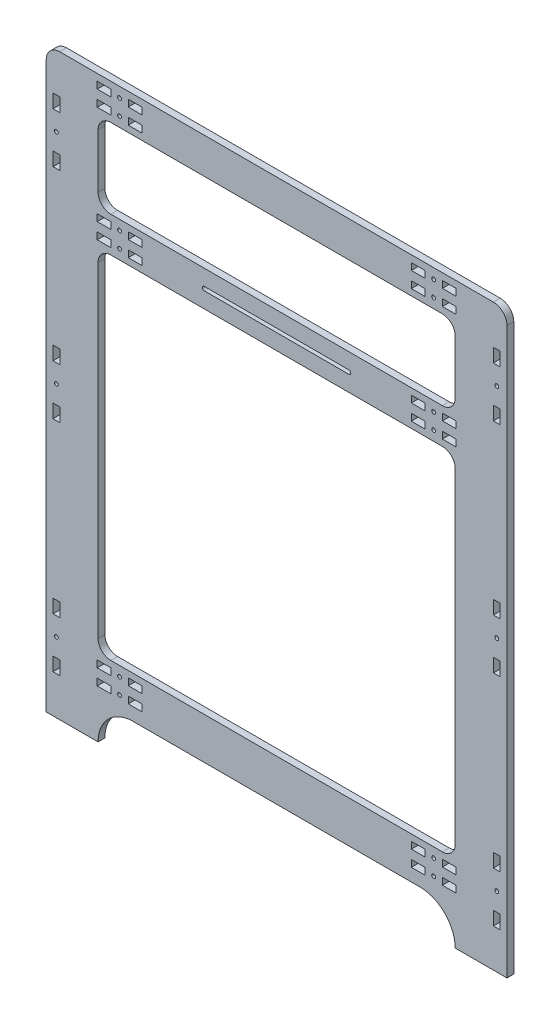
from build123d import *

# Parameters (mm, degrees)
SKETCH1_SIDE_SKETCH_2_W   = 5.333
SKETCH1_SIDE_SKETCH_2_H   = 10.666
SKETCH1_SIDE_SKETCH_2_W_2 = 10.666
SKETCH1_SIDE_SKETCH_2_H_2 = 5.333
SKETCH1_SIDE_SKETCH_2_R   = 1.5
BOSS_EXTRUDE1_DEPTH       = 5.333


with BuildPart() as part:
    # Sketch1-Side Sketch<2> → Boss-Extrude1 (new body)
    with BuildSketch(Plane.XY):
        with BuildLine():
            Line((170, 100.666), (-170, 100.666))
            ThreePointArc((-170, 100.666), (-177.542000928, 97.542000928), (-180.666, 90))
            Line((-180.666, 90), (-180.666, -353))
            Line((-180.666, -353), (-140, -353))
            ThreePointArc((-140, -353), (-131.896523315, -333.436476685), (-112.333, -325.333))
            Line((-112.333, -325.333), (112.333, -325.333))
            ThreePointArc((112.333, -325.333), (131.896523315, -333.436476685), (140, -353))
            Line((140, -353), (180.666, -353))
            Line((180.666, -353), (180.666, 90))
            ThreePointArc((180.666, 90), (177.542000928, 97.542000928), (170, 100.666))
        make_face()
        with Locations((172.6665, 64.667)):
            Rectangle(SKETCH1_SIDE_SKETCH_2_W, SKETCH1_SIDE_SKETCH_2_H, mode=Mode.SUBTRACT)
        with Locations((172.6665, 25.333)):
            Rectangle(SKETCH1_SIDE_SKETCH_2_W, SKETCH1_SIDE_SKETCH_2_H, mode=Mode.SUBTRACT)
        with Locations((172.6665, -106.5)):
            Rectangle(SKETCH1_SIDE_SKETCH_2_W, SKETCH1_SIDE_SKETCH_2_H, mode=Mode.SUBTRACT)
        with Locations((172.6665, -145.834)):
            Rectangle(SKETCH1_SIDE_SKETCH_2_W, SKETCH1_SIDE_SKETCH_2_H, mode=Mode.SUBTRACT)
        with Locations((172.6665, -278.333)):
            Rectangle(SKETCH1_SIDE_SKETCH_2_W, SKETCH1_SIDE_SKETCH_2_H, mode=Mode.SUBTRACT)
        with Locations((172.6665, -317.667)):
            Rectangle(SKETCH1_SIDE_SKETCH_2_W, SKETCH1_SIDE_SKETCH_2_H, mode=Mode.SUBTRACT)
        with Locations((-172.6665, -317.667)):
            Rectangle(SKETCH1_SIDE_SKETCH_2_W, SKETCH1_SIDE_SKETCH_2_H, mode=Mode.SUBTRACT)
        with Locations((-172.6665, -278.333)):
            Rectangle(SKETCH1_SIDE_SKETCH_2_W, SKETCH1_SIDE_SKETCH_2_H, mode=Mode.SUBTRACT)
        with Locations((-172.6665, -145.834)):
            Rectangle(SKETCH1_SIDE_SKETCH_2_W, SKETCH1_SIDE_SKETCH_2_H, mode=Mode.SUBTRACT)
        with Locations((-172.6665, -106.5)):
            Rectangle(SKETCH1_SIDE_SKETCH_2_W, SKETCH1_SIDE_SKETCH_2_H, mode=Mode.SUBTRACT)
        with Locations((-172.6665, 25.333)):
            Rectangle(SKETCH1_SIDE_SKETCH_2_W, SKETCH1_SIDE_SKETCH_2_H, mode=Mode.SUBTRACT)
        with Locations((-172.6665, 64.667)):
            Rectangle(SKETCH1_SIDE_SKETCH_2_W, SKETCH1_SIDE_SKETCH_2_H, mode=Mode.SUBTRACT)
        with Locations((-135.320282912, -312.6665)):
            Rectangle(SKETCH1_SIDE_SKETCH_2_W_2, SKETCH1_SIDE_SKETCH_2_H_2, mode=Mode.SUBTRACT)
        with Locations((-123.153282912, -312.6665)):
            Circle(SKETCH1_SIDE_SKETCH_2_R, mode=Mode.SUBTRACT)
        with Locations((-135.320282912, -300.3335)):
            Rectangle(SKETCH1_SIDE_SKETCH_2_W_2, SKETCH1_SIDE_SKETCH_2_H_2, mode=Mode.SUBTRACT)
        with Locations((-123.153282912, -300.3335)):
            Circle(SKETCH1_SIDE_SKETCH_2_R, mode=Mode.SUBTRACT)
        with Locations((-110.986282912, -312.6665)):
            Rectangle(SKETCH1_SIDE_SKETCH_2_W_2, SKETCH1_SIDE_SKETCH_2_H_2, mode=Mode.SUBTRACT)
        with Locations((-110.986282912, -300.3335)):
            Rectangle(SKETCH1_SIDE_SKETCH_2_W_2, SKETCH1_SIDE_SKETCH_2_H_2, mode=Mode.SUBTRACT)
        with Locations((110.986282912, -312.6665)):
            Rectangle(SKETCH1_SIDE_SKETCH_2_W_2, SKETCH1_SIDE_SKETCH_2_H_2, mode=Mode.SUBTRACT)
        with Locations((110.986282912, -300.3335)):
            Rectangle(SKETCH1_SIDE_SKETCH_2_W_2, SKETCH1_SIDE_SKETCH_2_H_2, mode=Mode.SUBTRACT)
        with Locations((123.153282912, -312.6665)):
            Circle(SKETCH1_SIDE_SKETCH_2_R, mode=Mode.SUBTRACT)
        with Locations((135.320282912, -312.6665)):
            Rectangle(SKETCH1_SIDE_SKETCH_2_W_2, SKETCH1_SIDE_SKETCH_2_H_2, mode=Mode.SUBTRACT)
        with Locations((123.153282912, -300.3335)):
            Circle(SKETCH1_SIDE_SKETCH_2_R, mode=Mode.SUBTRACT)
        with Locations((135.320282912, -300.3335)):
            Rectangle(SKETCH1_SIDE_SKETCH_2_W_2, SKETCH1_SIDE_SKETCH_2_H_2, mode=Mode.SUBTRACT)
        with BuildLine():
            Line((-130, -17.333), (130, -17.333))
            ThreePointArc((130, -17.333), (137.071067812, -20.261932188), (140, -27.333))
            Line((140, -27.333), (140, -282.667))
            ThreePointArc((140, -282.667), (137.071067812, -289.738067812), (130, -292.667))
            Line((130, -292.667), (-130, -292.667))
            ThreePointArc((-130, -292.667), (-137.071067812, -289.738067812), (-140, -282.667))
            Line((-140, -282.667), (-140, -27.333))
            ThreePointArc((-140, -27.333), (-137.071067812, -20.261932188), (-130, -17.333))
        make_face(mode=Mode.SUBTRACT)
        with Locations((-135.320282912, -9.6665)):
            Rectangle(SKETCH1_SIDE_SKETCH_2_W_2, SKETCH1_SIDE_SKETCH_2_H_2, mode=Mode.SUBTRACT)
        with Locations((-123.153282912, -9.6665)):
            Circle(SKETCH1_SIDE_SKETCH_2_R, mode=Mode.SUBTRACT)
        with Locations((-135.320282912, 2.6665)):
            Rectangle(SKETCH1_SIDE_SKETCH_2_W_2, SKETCH1_SIDE_SKETCH_2_H_2, mode=Mode.SUBTRACT)
        with Locations((-123.153282912, 2.6665)):
            Circle(SKETCH1_SIDE_SKETCH_2_R, mode=Mode.SUBTRACT)
        with Locations((-110.986282912, -9.6665)):
            Rectangle(SKETCH1_SIDE_SKETCH_2_W_2, SKETCH1_SIDE_SKETCH_2_H_2, mode=Mode.SUBTRACT)
        with Locations((-110.986282912, 2.6665)):
            Rectangle(SKETCH1_SIDE_SKETCH_2_W_2, SKETCH1_SIDE_SKETCH_2_H_2, mode=Mode.SUBTRACT)
        with Locations((-135.320282912, 80.3335)):
            Rectangle(SKETCH1_SIDE_SKETCH_2_W_2, SKETCH1_SIDE_SKETCH_2_H_2, mode=Mode.SUBTRACT)
        with Locations((-123.153282912, 80.3335)):
            Circle(SKETCH1_SIDE_SKETCH_2_R, mode=Mode.SUBTRACT)
        with Locations((-135.320282912, 92.6665)):
            Rectangle(SKETCH1_SIDE_SKETCH_2_W_2, SKETCH1_SIDE_SKETCH_2_H_2, mode=Mode.SUBTRACT)
        with Locations((-123.153282912, 92.6665)):
            Circle(SKETCH1_SIDE_SKETCH_2_R, mode=Mode.SUBTRACT)
        with Locations((-110.986282912, 80.3335)):
            Rectangle(SKETCH1_SIDE_SKETCH_2_W_2, SKETCH1_SIDE_SKETCH_2_H_2, mode=Mode.SUBTRACT)
        with Locations((-110.986282912, 92.6665)):
            Rectangle(SKETCH1_SIDE_SKETCH_2_W_2, SKETCH1_SIDE_SKETCH_2_H_2, mode=Mode.SUBTRACT)
        with BuildLine():
            Line((-130, 72.667), (130, 72.667))
            ThreePointArc((130, 72.667), (137.071067812, 69.738067812), (140, 62.667))
            Line((140, 62.667), (140, 20.333))
            ThreePointArc((140, 20.333), (137.071067812, 13.261932188), (130, 10.333))
            Line((130, 10.333), (-130, 10.333))
            ThreePointArc((-130, 10.333), (-137.071067812, 13.261932188), (-140, 20.333))
            Line((-140, 20.333), (-140, 62.667))
            ThreePointArc((-140, 62.667), (-137.071067812, 69.738067812), (-130, 72.667))
        make_face(mode=Mode.SUBTRACT)
        with BuildLine():
            ThreePointArc((-56.666666667, -5), (-58.166666667, -3.5), (-56.666666667, -2))
            Line((-56.666666667, -2), (56.666666667, -2))
            ThreePointArc((56.666666667, -2), (58.166666667, -3.5), (56.666666667, -5))
            Line((56.666666667, -5), (-56.666666667, -5))
        make_face(mode=Mode.SUBTRACT)
        with Locations((110.986282912, -9.6665)):
            Rectangle(SKETCH1_SIDE_SKETCH_2_W_2, SKETCH1_SIDE_SKETCH_2_H_2, mode=Mode.SUBTRACT)
        with Locations((110.986282912, 2.6665)):
            Rectangle(SKETCH1_SIDE_SKETCH_2_W_2, SKETCH1_SIDE_SKETCH_2_H_2, mode=Mode.SUBTRACT)
        with Locations((123.153282912, -9.6665)):
            Circle(SKETCH1_SIDE_SKETCH_2_R, mode=Mode.SUBTRACT)
        with Locations((135.320282912, -9.6665)):
            Rectangle(SKETCH1_SIDE_SKETCH_2_W_2, SKETCH1_SIDE_SKETCH_2_H_2, mode=Mode.SUBTRACT)
        with Locations((123.153282912, 2.6665)):
            Circle(SKETCH1_SIDE_SKETCH_2_R, mode=Mode.SUBTRACT)
        with Locations((135.320282912, 2.6665)):
            Rectangle(SKETCH1_SIDE_SKETCH_2_W_2, SKETCH1_SIDE_SKETCH_2_H_2, mode=Mode.SUBTRACT)
        with Locations((110.986282912, 80.3335)):
            Rectangle(SKETCH1_SIDE_SKETCH_2_W_2, SKETCH1_SIDE_SKETCH_2_H_2, mode=Mode.SUBTRACT)
        with Locations((110.986282912, 92.6665)):
            Rectangle(SKETCH1_SIDE_SKETCH_2_W_2, SKETCH1_SIDE_SKETCH_2_H_2, mode=Mode.SUBTRACT)
        with Locations((123.153282912, 80.3335)):
            Circle(SKETCH1_SIDE_SKETCH_2_R, mode=Mode.SUBTRACT)
        with Locations((135.320282912, 80.3335)):
            Rectangle(SKETCH1_SIDE_SKETCH_2_W_2, SKETCH1_SIDE_SKETCH_2_H_2, mode=Mode.SUBTRACT)
        with Locations((123.153282912, 92.6665)):
            Circle(SKETCH1_SIDE_SKETCH_2_R, mode=Mode.SUBTRACT)
        with Locations((135.320282912, 92.6665)):
            Rectangle(SKETCH1_SIDE_SKETCH_2_W_2, SKETCH1_SIDE_SKETCH_2_H_2, mode=Mode.SUBTRACT)
        with Locations((172.6665, -126.167)):
            Circle(SKETCH1_SIDE_SKETCH_2_R, mode=Mode.SUBTRACT)
        with Locations((172.6665, 45)):
            Circle(SKETCH1_SIDE_SKETCH_2_R, mode=Mode.SUBTRACT)
        with Locations((172.6665, -298)):
            Circle(SKETCH1_SIDE_SKETCH_2_R, mode=Mode.SUBTRACT)
        with Locations((-172.6665, -298)):
            Circle(SKETCH1_SIDE_SKETCH_2_R, mode=Mode.SUBTRACT)
        with Locations((-172.6665, -126.167)):
            Circle(SKETCH1_SIDE_SKETCH_2_R, mode=Mode.SUBTRACT)
        with Locations((-172.6665, 45)):
            Circle(SKETCH1_SIDE_SKETCH_2_R, mode=Mode.SUBTRACT)
    extrude(amount=BOSS_EXTRUDE1_DEPTH)


solid = part.part
